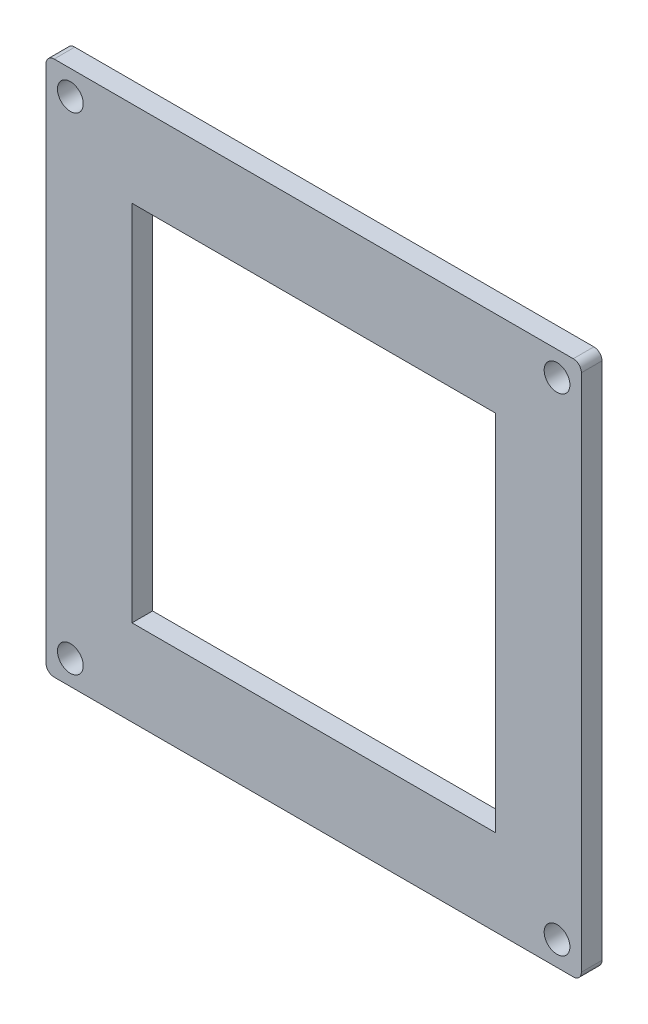
from build123d import *

# Parameters (mm, degrees)
SKETCH1_W           = 66
SKETCH1_H           = 66
SKETCH1_R           = 1.59
SKETCH1_W_2         = 44.8
SKETCH1_H_2         = 44.8
BOSS_EXTRUDE1_DEPTH = 2.54
FILLET1_R           = 1


with BuildPart() as part:
    # Sketch1 → Boss-Extrude1 (new body)
    with BuildSketch(Plane.XY):
        Rectangle(SKETCH1_W, SKETCH1_H)
        with Locations((30, 30)):
            Circle(SKETCH1_R, mode=Mode.SUBTRACT)
        with Locations((-30, 30)):
            Circle(SKETCH1_R, mode=Mode.SUBTRACT)
        with Locations((-30, -30)):
            Circle(SKETCH1_R, mode=Mode.SUBTRACT)
        with Locations((30, -30)):
            Circle(SKETCH1_R, mode=Mode.SUBTRACT)
        Rectangle(SKETCH1_W_2, SKETCH1_H_2, mode=Mode.SUBTRACT)
    extrude(amount=BOSS_EXTRUDE1_DEPTH)

    # Fillet1
    fillet1_edges = [part.edges().sort_by_distance(p)[0] for p in [
        (-33, 33, 1.27),
        (-33, -33, 1.27),
        (33, -33, 1.27),
        (33, 33, 1.27),
    ]]
    fillet(fillet1_edges, radius=FILLET1_R)


solid = part.part
